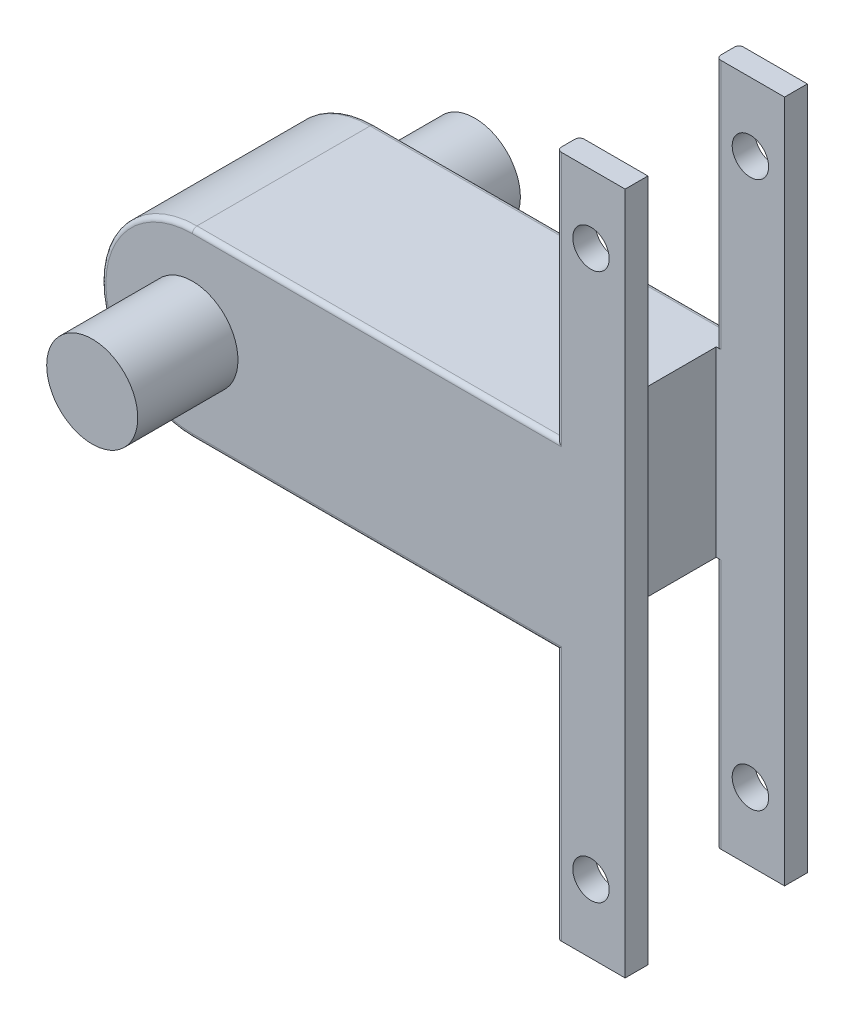
from build123d import *

# Parameters (mm, degrees)
SKETCH1_R           = 4
BOSS_EXTRUDE1_DEPTH = 40
SKETCH2_R           = 10
BOSS_EXTRUDE2_DEPTH = 22
SKETCH3_W           = 15
SKETCH3_H           = 30
CUT_EXTRUDE1_DEPTH  = 150
FILLET1_R           = 1


with BuildPart() as part:
    # Sketch1 → Boss-Extrude1 (new body)
    with BuildSketch(Plane.XY):
        with BuildLine():
            Line((0, 75), (0, 20))
            Line((0, 20), (-80, 20))
            ThreePointArc((-80, 20), (-100, 0), (-80, -20))
            Line((-80, -20), (0, -20))
            Line((0, -20), (0, -75))
            Line((0, -75), (15, -75))
            Line((15, -75), (15, 75))
            Line((15, 75), (0, 75))
        make_face()
        with Locations((7.5, 60)):
            Circle(SKETCH1_R, mode=Mode.SUBTRACT)
        with Locations((7.5, -60)):
            Circle(SKETCH1_R, mode=Mode.SUBTRACT)
    extrude(amount=BOSS_EXTRUDE1_DEPTH)

    # Sketch2 → Boss-Extrude2 (add)
    with BuildSketch(Plane(origin=(0, 0, 0), x_dir=(-1, 0, 0), z_dir=(0, 0, -1))):
        with Locations((80, 0)):
            Circle(SKETCH2_R)
    boss_extrude2 = extrude(amount=BOSS_EXTRUDE2_DEPTH)

    # Mirror1: Boss-Extrude2 across plane
    add(boss_extrude2.mirror(Plane.XY.offset(20)))

    # Sketch3 → Cut-Extrude1 (cut)
    with BuildSketch(Plane(origin=(0, 75, 0), x_dir=(1, 0, 0), z_dir=(0, 1, 0))):
        with Locations((7.5, -20)):
            Rectangle(SKETCH3_W, SKETCH3_H)
    extrude(amount=-CUT_EXTRUDE1_DEPTH, mode=Mode.SUBTRACT)

    # Fillet1
    fillet1_edges = [part.edges().sort_by_distance(p)[0] for p in [
        (-40, -20, 0),
        (-100, 0, 0),
        (-40, -20, 40),
        (-100, 0, 40),
        (0, -47.5, 0),
        (0, -47.5, 5),
        (0, -47.5, 35),
        (0, -47.5, 40),
        (0, 47.5, 40),
        (0, 47.5, 35),
        (0, 47.5, 5),
        (0, 47.5, 0),
        (-40, 20, 0),
        (-40, 20, 40),
    ]]
    fillet(fillet1_edges, radius=FILLET1_R)


solid = part.part
